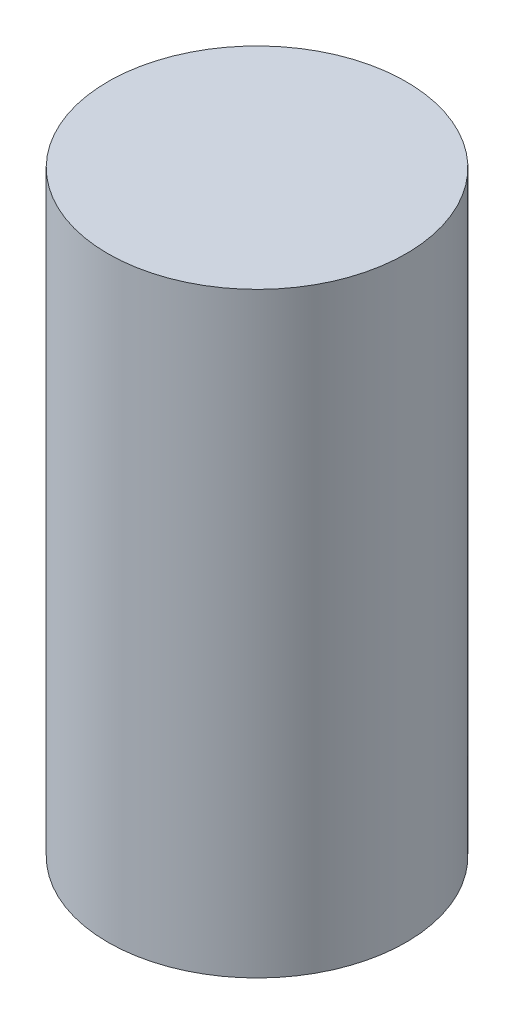
from build123d import *

# Parameters (mm, degrees)
SKETCH1_R           = 1
BOSS_EXTRUDE1_DEPTH = 4


with BuildPart() as part:
    # Sketch1 → Boss-Extrude1 (new body)
    with BuildSketch(Plane(origin=(0, 0, 0), x_dir=(1, 0, 0), z_dir=(0, 1, 0))):
        Circle(SKETCH1_R)
    extrude(amount=BOSS_EXTRUDE1_DEPTH)


solid = part.part
